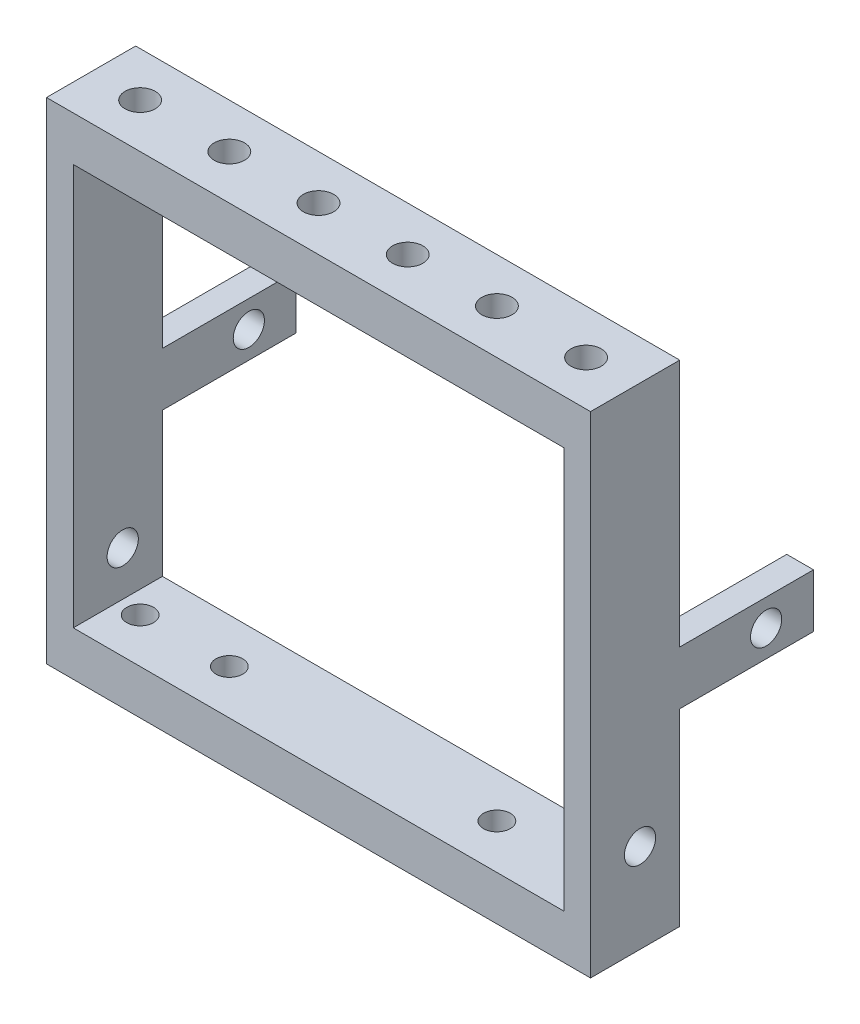
from build123d import *

# Parameters (mm, degrees)
SKETCH1_W           = 61
SKETCH1_H           = 10
SKETCH1_R           = 1.5
BOSS_EXTRUDE1_DEPTH = 5
SKETCH2_W           = 3
SKETCH2_H           = 10
BOSS_EXTRUDE2_DEPTH = 45
SKETCH3_R           = 1.75
CUT_EXTRUDE1_DEPTH  = 80.072172407
SKETCH4_W           = 15
SKETCH4_H           = 6
BOSS_EXTRUDE3_DEPTH = 3
SKETCH5_R           = 1.75
CUT_EXTRUDE2_DEPTH  = 82.52017035
SKETCH6_W           = 61
SKETCH6_H           = 10
SKETCH6_R           = 1.7
BOSS_EXTRUDE4_DEPTH = 5


with BuildPart() as part:
    # Sketch1 → Boss-Extrude1 (new body)
    with BuildSketch(Plane(origin=(0, 0, 0), x_dir=(1, 0, 0), z_dir=(0, 1, 0))):
        with Locations((7.144615438, 0.604324155)):
            Rectangle(SKETCH1_W, SKETCH1_H)
        with Locations((-17.855384562, 0.604324155)):
            Circle(SKETCH1_R, mode=Mode.SUBTRACT)
        with Locations((-7.855384562, 0.604324155)):
            Circle(SKETCH1_R, mode=Mode.SUBTRACT)
        with Locations((22.144615438, 0.604324155)):
            Circle(SKETCH1_R, mode=Mode.SUBTRACT)
        with Locations((32.144615438, 0.604324155)):
            Circle(SKETCH1_R, mode=Mode.SUBTRACT)
    extrude(amount=BOSS_EXTRUDE1_DEPTH)

    # Sketch2 → Boss-Extrude2 (add)
    with BuildSketch(Plane(origin=(0, 5, 0), x_dir=(1, 0, 0), z_dir=(0, 1, 0))):
        with Locations((36.144615438, 0.604324155)):
            Rectangle(SKETCH2_W, SKETCH2_H)
        with Locations((-21.855384562, 0.604324155)):
            Rectangle(SKETCH2_W, SKETCH2_H)
    extrude(amount=BOSS_EXTRUDE2_DEPTH)

    # Sketch3 → Cut-Extrude1 (cut, through all)
    with BuildSketch(Plane.ZY.offset(23.355384562)):
        with Locations((-1.152150748, 10)):
            Circle(SKETCH3_R)
    extrude(amount=-CUT_EXTRUDE1_DEPTH, mode=Mode.SUBTRACT)

    # Sketch4 → Boss-Extrude3 (add)
    with BuildSketch(Plane.ZY.offset(23.355384562)):
        with Locations((-13.104324155, 24.14)):
            Rectangle(SKETCH4_W, SKETCH4_H)
    boss_extrude3 = extrude(amount=-BOSS_EXTRUDE3_DEPTH)

    # Mirror1: Boss-Extrude3 across plane
    add(boss_extrude3.mirror(Plane.ZY.offset(-7.144615438)))

    # Sketch5 → Cut-Extrude2 (cut, through all)
    with BuildSketch(Plane.ZY.offset(23.355384562)):
        with Locations((-15.292150748, 24.14)):
            Circle(SKETCH5_R)
    extrude(amount=-CUT_EXTRUDE2_DEPTH, mode=Mode.SUBTRACT)

    # Sketch6 → Boss-Extrude4 (add)
    with BuildSketch(Plane(origin=(0, 50, 0), x_dir=(1, 0, 0), z_dir=(0, 1, 0))):
        with Locations((7.144615438, 0.604324155)):
            Rectangle(SKETCH6_W, SKETCH6_H)
        with Locations((2.144615438, 0.604324155)):
            Circle(SKETCH6_R, mode=Mode.SUBTRACT)
        with Locations((12.144615438, 0.604324155)):
            Circle(SKETCH6_R, mode=Mode.SUBTRACT)
        with Locations((-7.855384562, 0.604324155)):
            Circle(SKETCH6_R, mode=Mode.SUBTRACT)
        with Locations((-17.855384562, 0.604324155)):
            Circle(SKETCH6_R, mode=Mode.SUBTRACT)
        with Locations((22.144615438, 0.604324155)):
            Circle(SKETCH6_R, mode=Mode.SUBTRACT)
        with Locations((32.144615438, 0.604324155)):
            Circle(SKETCH6_R, mode=Mode.SUBTRACT)
    extrude(amount=BOSS_EXTRUDE4_DEPTH)


solid = part.part
